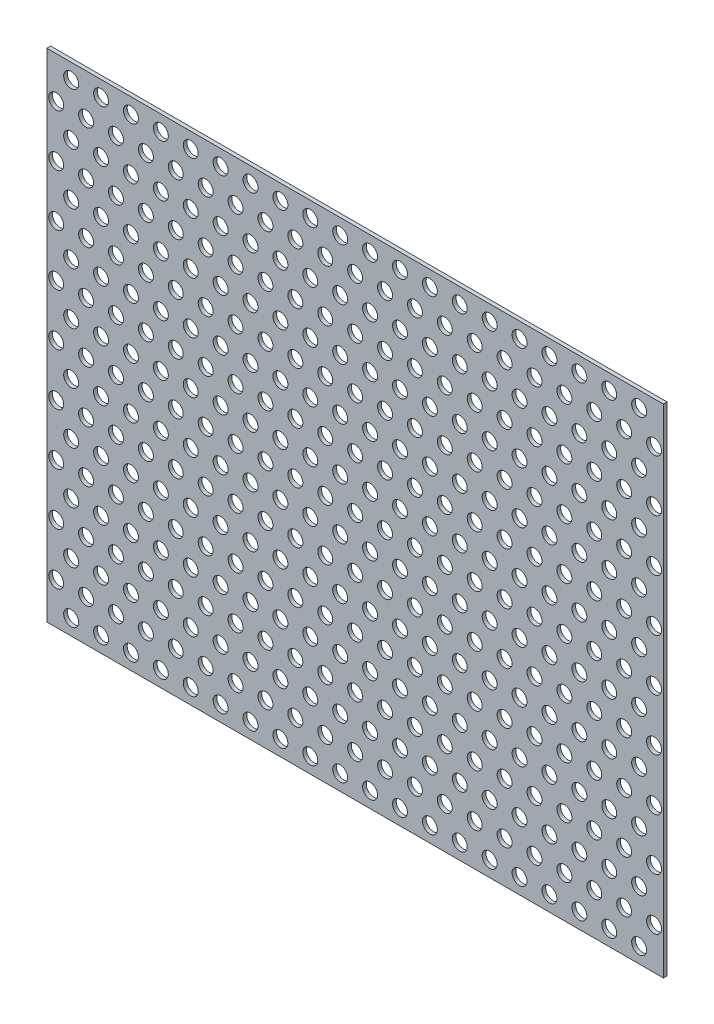
from build123d import *

# Parameters (mm, degrees)
SKICA1_W                  = 165
SKICA1_H                  = 135
Z_KLADN_PLECH1_DEPTH      = 1
POLE_START                = -1
POLE_VYPLN_N_M1_OUTLINE_R = 2
POLE_VYPLN_N_M1_DEPTH     = 1
SKICA4_W                  = 165
SKICA4_H                  = 1
ODEBRAT_VYSUNUT_M9_DEPTH  = 1


# Read off the part's stored shape, not the designer's step: Pole vyplněním1
# Sheet-metal steps are written as plain solids
with BuildPart() as part:
    # Skica1 → Základní plech1 (new body)
    with BuildSketch(Plane.XY):
        with Locations((82.5, 67.5)):
            Rectangle(SKICA1_W, SKICA1_H)
    extrude(amount=-Z_KLADN_PLECH1_DEPTH)

    # Pole vyplněním1 outline → Pole vyplněním1 (cut)
    with BuildSketch(Plane.XY.offset(POLE_START)):
        with Locations((2.5, 122.925625842)):
            Circle(POLE_VYPLN_N_M1_OUTLINE_R)
        with Locations((62.5, 129.853829072)):
            Circle(POLE_VYPLN_N_M1_OUTLINE_R)
        with Locations((62.5, 115.997422612)):
            Circle(POLE_VYPLN_N_M1_OUTLINE_R)
        with Locations((66.5, 109.069219382)):
            Circle(POLE_VYPLN_N_M1_OUTLINE_R)
        with Locations((74.5, 109.069219382)):
            Circle(POLE_VYPLN_N_M1_OUTLINE_R)
        with Locations((82.5, 109.069219382)):
            Circle(POLE_VYPLN_N_M1_OUTLINE_R)
        with Locations((90.5, 109.069219382)):
            Circle(POLE_VYPLN_N_M1_OUTLINE_R)
        with Locations((98.5, 109.069219382)):
            Circle(POLE_VYPLN_N_M1_OUTLINE_R)
        with Locations((106.5, 109.069219382)):
            Circle(POLE_VYPLN_N_M1_OUTLINE_R)
        with Locations((146.5, 109.069219382)):
            Circle(POLE_VYPLN_N_M1_OUTLINE_R)
        with Locations((154.5, 109.069219382)):
            Circle(POLE_VYPLN_N_M1_OUTLINE_R)
        with Locations((162.5, 109.069219382)):
            Circle(POLE_VYPLN_N_M1_OUTLINE_R)
        with Locations((66.5, 122.925625842)):
            Circle(POLE_VYPLN_N_M1_OUTLINE_R)
        with Locations((138.5, 109.069219382)):
            Circle(POLE_VYPLN_N_M1_OUTLINE_R)
        with Locations((130.5, 109.069219382)):
            Circle(POLE_VYPLN_N_M1_OUTLINE_R)
        with Locations((122.5, 109.069219382)):
            Circle(POLE_VYPLN_N_M1_OUTLINE_R)
        with Locations((114.5, 109.069219382)):
            Circle(POLE_VYPLN_N_M1_OUTLINE_R)
        with Locations((94.5, 102.141016151)):
            Circle(POLE_VYPLN_N_M1_OUTLINE_R)
        with Locations((86.5, 102.141016151)):
            Circle(POLE_VYPLN_N_M1_OUTLINE_R)
        with Locations((78.5, 102.141016151)):
            Circle(POLE_VYPLN_N_M1_OUTLINE_R)
        with Locations((70.5, 102.141016151)):
            Circle(POLE_VYPLN_N_M1_OUTLINE_R)
        with Locations((162.5, 95.212812921)):
            Circle(POLE_VYPLN_N_M1_OUTLINE_R)
        with Locations((58.5, 122.925625842)):
            Circle(POLE_VYPLN_N_M1_OUTLINE_R)
        with Locations((58.5, 109.069219382)):
            Circle(POLE_VYPLN_N_M1_OUTLINE_R)
        with Locations((62.5, 102.141016151)):
            Circle(POLE_VYPLN_N_M1_OUTLINE_R)
        with Locations((102.5, 102.141016151)):
            Circle(POLE_VYPLN_N_M1_OUTLINE_R)
        with Locations((110.5, 102.141016151)):
            Circle(POLE_VYPLN_N_M1_OUTLINE_R)
        with Locations((118.5, 102.141016151)):
            Circle(POLE_VYPLN_N_M1_OUTLINE_R)
        with Locations((126.5, 102.141016151)):
            Circle(POLE_VYPLN_N_M1_OUTLINE_R)
        with Locations((134.5, 102.141016151)):
            Circle(POLE_VYPLN_N_M1_OUTLINE_R)
        with Locations((142.5, 102.141016151)):
            Circle(POLE_VYPLN_N_M1_OUTLINE_R)
        with Locations((150.5, 102.141016151)):
            Circle(POLE_VYPLN_N_M1_OUTLINE_R)
        with Locations((158.5, 102.141016151)):
            Circle(POLE_VYPLN_N_M1_OUTLINE_R)
        with Locations((98.5, 122.925625842)):
            Circle(POLE_VYPLN_N_M1_OUTLINE_R)
        with Locations((106.5, 122.925625842)):
            Circle(POLE_VYPLN_N_M1_OUTLINE_R)
        with Locations((114.5, 122.925625842)):
            Circle(POLE_VYPLN_N_M1_OUTLINE_R)
        with Locations((122.5, 122.925625842)):
            Circle(POLE_VYPLN_N_M1_OUTLINE_R)
        with Locations((130.5, 122.925625842)):
            Circle(POLE_VYPLN_N_M1_OUTLINE_R)
        with Locations((138.5, 122.925625842)):
            Circle(POLE_VYPLN_N_M1_OUTLINE_R)
        with Locations((146.5, 122.925625842)):
            Circle(POLE_VYPLN_N_M1_OUTLINE_R)
        with Locations((154.5, 122.925625842)):
            Circle(POLE_VYPLN_N_M1_OUTLINE_R)
        with Locations((126.5, 129.853829072)):
            Circle(POLE_VYPLN_N_M1_OUTLINE_R)
        with Locations((118.5, 129.853829072)):
            Circle(POLE_VYPLN_N_M1_OUTLINE_R)
        with Locations((110.5, 129.853829072)):
            Circle(POLE_VYPLN_N_M1_OUTLINE_R)
        with Locations((102.5, 129.853829072)):
            Circle(POLE_VYPLN_N_M1_OUTLINE_R)
        with Locations((162.5, 122.925625842)):
            Circle(POLE_VYPLN_N_M1_OUTLINE_R)
        with Locations((78.5, 129.853829072)):
            Circle(POLE_VYPLN_N_M1_OUTLINE_R)
        with Locations((86.5, 129.853829072)):
            Circle(POLE_VYPLN_N_M1_OUTLINE_R)
        with Locations((94.5, 129.853829072)):
            Circle(POLE_VYPLN_N_M1_OUTLINE_R)
        with Locations((70.5, 115.997422612)):
            Circle(POLE_VYPLN_N_M1_OUTLINE_R)
        with Locations((78.5, 115.997422612)):
            Circle(POLE_VYPLN_N_M1_OUTLINE_R)
        with Locations((86.5, 115.997422612)):
            Circle(POLE_VYPLN_N_M1_OUTLINE_R)
        with Locations((94.5, 115.997422612)):
            Circle(POLE_VYPLN_N_M1_OUTLINE_R)
        with Locations((102.5, 115.997422612)):
            Circle(POLE_VYPLN_N_M1_OUTLINE_R)
        with Locations((110.5, 115.997422612)):
            Circle(POLE_VYPLN_N_M1_OUTLINE_R)
        with Locations((118.5, 115.997422612)):
            Circle(POLE_VYPLN_N_M1_OUTLINE_R)
        with Locations((126.5, 115.997422612)):
            Circle(POLE_VYPLN_N_M1_OUTLINE_R)
        with Locations((134.5, 115.997422612)):
            Circle(POLE_VYPLN_N_M1_OUTLINE_R)
        with Locations((142.5, 115.997422612)):
            Circle(POLE_VYPLN_N_M1_OUTLINE_R)
        with Locations((150.5, 115.997422612)):
            Circle(POLE_VYPLN_N_M1_OUTLINE_R)
        with Locations((158.5, 115.997422612)):
            Circle(POLE_VYPLN_N_M1_OUTLINE_R)
        with Locations((70.5, 129.853829072)):
            Circle(POLE_VYPLN_N_M1_OUTLINE_R)
        with Locations((74.5, 122.925625842)):
            Circle(POLE_VYPLN_N_M1_OUTLINE_R)
        with Locations((82.5, 122.925625842)):
            Circle(POLE_VYPLN_N_M1_OUTLINE_R)
        with Locations((90.5, 122.925625842)):
            Circle(POLE_VYPLN_N_M1_OUTLINE_R)
        with Locations((50.5, 81.356406461)):
            Circle(POLE_VYPLN_N_M1_OUTLINE_R)
        with Locations((58.5, 81.356406461)):
            Circle(POLE_VYPLN_N_M1_OUTLINE_R)
        with Locations((66.5, 81.356406461)):
            Circle(POLE_VYPLN_N_M1_OUTLINE_R)
        with Locations((74.5, 81.356406461)):
            Circle(POLE_VYPLN_N_M1_OUTLINE_R)
        with Locations((82.5, 81.356406461)):
            Circle(POLE_VYPLN_N_M1_OUTLINE_R)
        with Locations((90.5, 81.356406461)):
            Circle(POLE_VYPLN_N_M1_OUTLINE_R)
        with Locations((98.5, 81.356406461)):
            Circle(POLE_VYPLN_N_M1_OUTLINE_R)
        with Locations((106.5, 81.356406461)):
            Circle(POLE_VYPLN_N_M1_OUTLINE_R)
        with Locations((146.5, 81.356406461)):
            Circle(POLE_VYPLN_N_M1_OUTLINE_R)
        with Locations((154.5, 81.356406461)):
            Circle(POLE_VYPLN_N_M1_OUTLINE_R)
        with Locations((162.5, 81.356406461)):
            Circle(POLE_VYPLN_N_M1_OUTLINE_R)
        with Locations((50.5, 122.925625842)):
            Circle(POLE_VYPLN_N_M1_OUTLINE_R)
        with Locations((138.5, 81.356406461)):
            Circle(POLE_VYPLN_N_M1_OUTLINE_R)
        with Locations((130.5, 81.356406461)):
            Circle(POLE_VYPLN_N_M1_OUTLINE_R)
        with Locations((122.5, 81.356406461)):
            Circle(POLE_VYPLN_N_M1_OUTLINE_R)
        with Locations((114.5, 81.356406461)):
            Circle(POLE_VYPLN_N_M1_OUTLINE_R)
        with Locations((70.5, 74.42820323)):
            Circle(POLE_VYPLN_N_M1_OUTLINE_R)
        with Locations((78.5, 74.42820323)):
            Circle(POLE_VYPLN_N_M1_OUTLINE_R)
        with Locations((86.5, 74.42820323)):
            Circle(POLE_VYPLN_N_M1_OUTLINE_R)
        with Locations((94.5, 74.42820323)):
            Circle(POLE_VYPLN_N_M1_OUTLINE_R)
        with Locations((102.5, 74.42820323)):
            Circle(POLE_VYPLN_N_M1_OUTLINE_R)
        with Locations((110.5, 74.42820323)):
            Circle(POLE_VYPLN_N_M1_OUTLINE_R)
        with Locations((118.5, 74.42820323)):
            Circle(POLE_VYPLN_N_M1_OUTLINE_R)
        with Locations((126.5, 74.42820323)):
            Circle(POLE_VYPLN_N_M1_OUTLINE_R)
        with Locations((134.5, 74.42820323)):
            Circle(POLE_VYPLN_N_M1_OUTLINE_R)
        with Locations((142.5, 74.42820323)):
            Circle(POLE_VYPLN_N_M1_OUTLINE_R)
        with Locations((150.5, 74.42820323)):
            Circle(POLE_VYPLN_N_M1_OUTLINE_R)
        with Locations((158.5, 74.42820323)):
            Circle(POLE_VYPLN_N_M1_OUTLINE_R)
        with Locations((46.5, 129.853829072)):
            Circle(POLE_VYPLN_N_M1_OUTLINE_R)
        with Locations((46.5, 115.997422612)):
            Circle(POLE_VYPLN_N_M1_OUTLINE_R)
        with Locations((46.5, 102.141016151)):
            Circle(POLE_VYPLN_N_M1_OUTLINE_R)
        with Locations((46.5, 88.284609691)):
            Circle(POLE_VYPLN_N_M1_OUTLINE_R)
        with Locations((154.5, 95.212812921)):
            Circle(POLE_VYPLN_N_M1_OUTLINE_R)
        with Locations((146.5, 95.212812921)):
            Circle(POLE_VYPLN_N_M1_OUTLINE_R)
        with Locations((138.5, 95.212812921)):
            Circle(POLE_VYPLN_N_M1_OUTLINE_R)
        with Locations((130.5, 95.212812921)):
            Circle(POLE_VYPLN_N_M1_OUTLINE_R)
        with Locations((122.5, 95.212812921)):
            Circle(POLE_VYPLN_N_M1_OUTLINE_R)
        with Locations((114.5, 95.212812921)):
            Circle(POLE_VYPLN_N_M1_OUTLINE_R)
        with Locations((106.5, 95.212812921)):
            Circle(POLE_VYPLN_N_M1_OUTLINE_R)
        with Locations((98.5, 95.212812921)):
            Circle(POLE_VYPLN_N_M1_OUTLINE_R)
        with Locations((90.5, 95.212812921)):
            Circle(POLE_VYPLN_N_M1_OUTLINE_R)
        with Locations((82.5, 95.212812921)):
            Circle(POLE_VYPLN_N_M1_OUTLINE_R)
        with Locations((74.5, 95.212812921)):
            Circle(POLE_VYPLN_N_M1_OUTLINE_R)
        with Locations((66.5, 95.212812921)):
            Circle(POLE_VYPLN_N_M1_OUTLINE_R)
        with Locations((58.5, 95.212812921)):
            Circle(POLE_VYPLN_N_M1_OUTLINE_R)
        with Locations((54.5, 102.141016151)):
            Circle(POLE_VYPLN_N_M1_OUTLINE_R)
        with Locations((54.5, 115.997422612)):
            Circle(POLE_VYPLN_N_M1_OUTLINE_R)
        with Locations((54.5, 129.853829072)):
            Circle(POLE_VYPLN_N_M1_OUTLINE_R)
        with Locations((158.5, 88.284609691)):
            Circle(POLE_VYPLN_N_M1_OUTLINE_R)
        with Locations((150.5, 88.284609691)):
            Circle(POLE_VYPLN_N_M1_OUTLINE_R)
        with Locations((142.5, 88.284609691)):
            Circle(POLE_VYPLN_N_M1_OUTLINE_R)
        with Locations((134.5, 88.284609691)):
            Circle(POLE_VYPLN_N_M1_OUTLINE_R)
        with Locations((126.5, 88.284609691)):
            Circle(POLE_VYPLN_N_M1_OUTLINE_R)
        with Locations((118.5, 88.284609691)):
            Circle(POLE_VYPLN_N_M1_OUTLINE_R)
        with Locations((110.5, 88.284609691)):
            Circle(POLE_VYPLN_N_M1_OUTLINE_R)
        with Locations((102.5, 88.284609691)):
            Circle(POLE_VYPLN_N_M1_OUTLINE_R)
        with Locations((94.5, 88.284609691)):
            Circle(POLE_VYPLN_N_M1_OUTLINE_R)
        with Locations((86.5, 88.284609691)):
            Circle(POLE_VYPLN_N_M1_OUTLINE_R)
        with Locations((78.5, 88.284609691)):
            Circle(POLE_VYPLN_N_M1_OUTLINE_R)
        with Locations((70.5, 88.284609691)):
            Circle(POLE_VYPLN_N_M1_OUTLINE_R)
        with Locations((62.5, 88.284609691)):
            Circle(POLE_VYPLN_N_M1_OUTLINE_R)
        with Locations((54.5, 88.284609691)):
            Circle(POLE_VYPLN_N_M1_OUTLINE_R)
        with Locations((50.5, 95.212812921)):
            Circle(POLE_VYPLN_N_M1_OUTLINE_R)
        with Locations((50.5, 109.069219382)):
            Circle(POLE_VYPLN_N_M1_OUTLINE_R)
        with Locations((134.5, 129.853829072)):
            Circle(POLE_VYPLN_N_M1_OUTLINE_R)
        with Locations((142.5, 129.853829072)):
            Circle(POLE_VYPLN_N_M1_OUTLINE_R)
        with Locations((150.5, 129.853829072)):
            Circle(POLE_VYPLN_N_M1_OUTLINE_R)
        with Locations((158.5, 129.853829072)):
            Circle(POLE_VYPLN_N_M1_OUTLINE_R)
        with Locations((134.5, 19.002577388)):
            Circle(POLE_VYPLN_N_M1_OUTLINE_R)
        with Locations((142.5, 19.002577388)):
            Circle(POLE_VYPLN_N_M1_OUTLINE_R)
        with Locations((150.5, 19.002577388)):
            Circle(POLE_VYPLN_N_M1_OUTLINE_R)
        with Locations((158.5, 19.002577388)):
            Circle(POLE_VYPLN_N_M1_OUTLINE_R)
        with Locations((14.5, 129.853829072)):
            Circle(POLE_VYPLN_N_M1_OUTLINE_R)
        with Locations((14.5, 115.997422612)):
            Circle(POLE_VYPLN_N_M1_OUTLINE_R)
        with Locations((14.5, 102.141016151)):
            Circle(POLE_VYPLN_N_M1_OUTLINE_R)
        with Locations((14.5, 88.284609691)):
            Circle(POLE_VYPLN_N_M1_OUTLINE_R)
        with Locations((14.5, 74.42820323)):
            Circle(POLE_VYPLN_N_M1_OUTLINE_R)
        with Locations((14.5, 60.57179677)):
            Circle(POLE_VYPLN_N_M1_OUTLINE_R)
        with Locations((14.5, 46.715390309)):
            Circle(POLE_VYPLN_N_M1_OUTLINE_R)
        with Locations((14.5, 32.858983849)):
            Circle(POLE_VYPLN_N_M1_OUTLINE_R)
        with Locations((18.5, 25.930780618)):
            Circle(POLE_VYPLN_N_M1_OUTLINE_R)
        with Locations((26.5, 25.930780618)):
            Circle(POLE_VYPLN_N_M1_OUTLINE_R)
        with Locations((34.5, 25.930780618)):
            Circle(POLE_VYPLN_N_M1_OUTLINE_R)
        with Locations((42.5, 25.930780618)):
            Circle(POLE_VYPLN_N_M1_OUTLINE_R)
        with Locations((126.5, 19.002577388)):
            Circle(POLE_VYPLN_N_M1_OUTLINE_R)
        with Locations((118.5, 19.002577388)):
            Circle(POLE_VYPLN_N_M1_OUTLINE_R)
        with Locations((110.5, 19.002577388)):
            Circle(POLE_VYPLN_N_M1_OUTLINE_R)
        with Locations((102.5, 19.002577388)):
            Circle(POLE_VYPLN_N_M1_OUTLINE_R)
        with Locations((94.5, 19.002577388)):
            Circle(POLE_VYPLN_N_M1_OUTLINE_R)
        with Locations((86.5, 19.002577388)):
            Circle(POLE_VYPLN_N_M1_OUTLINE_R)
        with Locations((78.5, 19.002577388)):
            Circle(POLE_VYPLN_N_M1_OUTLINE_R)
        with Locations((70.5, 19.002577388)):
            Circle(POLE_VYPLN_N_M1_OUTLINE_R)
        with Locations((62.5, 19.002577388)):
            Circle(POLE_VYPLN_N_M1_OUTLINE_R)
        with Locations((54.5, 19.002577388)):
            Circle(POLE_VYPLN_N_M1_OUTLINE_R)
        with Locations((46.5, 19.002577388)):
            Circle(POLE_VYPLN_N_M1_OUTLINE_R)
        with Locations((38.5, 19.002577388)):
            Circle(POLE_VYPLN_N_M1_OUTLINE_R)
        with Locations((30.5, 19.002577388)):
            Circle(POLE_VYPLN_N_M1_OUTLINE_R)
        with Locations((22.5, 19.002577388)):
            Circle(POLE_VYPLN_N_M1_OUTLINE_R)
        with Locations((14.5, 19.002577388)):
            Circle(POLE_VYPLN_N_M1_OUTLINE_R)
        with Locations((10.5, 25.930780618)):
            Circle(POLE_VYPLN_N_M1_OUTLINE_R)
        with Locations((94.5, 32.858983849)):
            Circle(POLE_VYPLN_N_M1_OUTLINE_R)
        with Locations((86.5, 32.858983849)):
            Circle(POLE_VYPLN_N_M1_OUTLINE_R)
        with Locations((78.5, 32.858983849)):
            Circle(POLE_VYPLN_N_M1_OUTLINE_R)
        with Locations((70.5, 32.858983849)):
            Circle(POLE_VYPLN_N_M1_OUTLINE_R)
        with Locations((62.5, 32.858983849)):
            Circle(POLE_VYPLN_N_M1_OUTLINE_R)
        with Locations((54.5, 32.858983849)):
            Circle(POLE_VYPLN_N_M1_OUTLINE_R)
        with Locations((46.5, 32.858983849)):
            Circle(POLE_VYPLN_N_M1_OUTLINE_R)
        with Locations((38.5, 32.858983849)):
            Circle(POLE_VYPLN_N_M1_OUTLINE_R)
        with Locations((30.5, 32.858983849)):
            Circle(POLE_VYPLN_N_M1_OUTLINE_R)
        with Locations((22.5, 32.858983849)):
            Circle(POLE_VYPLN_N_M1_OUTLINE_R)
        with Locations((18.5, 39.787187079)):
            Circle(POLE_VYPLN_N_M1_OUTLINE_R)
        with Locations((18.5, 53.643593539)):
            Circle(POLE_VYPLN_N_M1_OUTLINE_R)
        with Locations((18.5, 67.5)):
            Circle(POLE_VYPLN_N_M1_OUTLINE_R)
        with Locations((18.5, 81.356406461)):
            Circle(POLE_VYPLN_N_M1_OUTLINE_R)
        with Locations((18.5, 95.212812921)):
            Circle(POLE_VYPLN_N_M1_OUTLINE_R)
        with Locations((18.5, 109.069219382)):
            Circle(POLE_VYPLN_N_M1_OUTLINE_R)
        with Locations((50.5, 25.930780618)):
            Circle(POLE_VYPLN_N_M1_OUTLINE_R)
        with Locations((58.5, 25.930780618)):
            Circle(POLE_VYPLN_N_M1_OUTLINE_R)
        with Locations((66.5, 25.930780618)):
            Circle(POLE_VYPLN_N_M1_OUTLINE_R)
        with Locations((74.5, 25.930780618)):
            Circle(POLE_VYPLN_N_M1_OUTLINE_R)
        with Locations((82.5, 25.930780618)):
            Circle(POLE_VYPLN_N_M1_OUTLINE_R)
        with Locations((90.5, 25.930780618)):
            Circle(POLE_VYPLN_N_M1_OUTLINE_R)
        with Locations((98.5, 25.930780618)):
            Circle(POLE_VYPLN_N_M1_OUTLINE_R)
        with Locations((106.5, 25.930780618)):
            Circle(POLE_VYPLN_N_M1_OUTLINE_R)
        with Locations((146.5, 25.930780618)):
            Circle(POLE_VYPLN_N_M1_OUTLINE_R)
        with Locations((154.5, 25.930780618)):
            Circle(POLE_VYPLN_N_M1_OUTLINE_R)
        with Locations((162.5, 25.930780618)):
            Circle(POLE_VYPLN_N_M1_OUTLINE_R)
        with Locations((18.5, 122.925625842)):
            Circle(POLE_VYPLN_N_M1_OUTLINE_R)
        with Locations((138.5, 25.930780618)):
            Circle(POLE_VYPLN_N_M1_OUTLINE_R)
        with Locations((130.5, 25.930780618)):
            Circle(POLE_VYPLN_N_M1_OUTLINE_R)
        with Locations((122.5, 25.930780618)):
            Circle(POLE_VYPLN_N_M1_OUTLINE_R)
        with Locations((114.5, 25.930780618)):
            Circle(POLE_VYPLN_N_M1_OUTLINE_R)
        with Locations((70.5, 5.146170928)):
            Circle(POLE_VYPLN_N_M1_OUTLINE_R)
        with Locations((78.5, 5.146170928)):
            Circle(POLE_VYPLN_N_M1_OUTLINE_R)
        with Locations((86.5, 5.146170928)):
            Circle(POLE_VYPLN_N_M1_OUTLINE_R)
        with Locations((94.5, 5.146170928)):
            Circle(POLE_VYPLN_N_M1_OUTLINE_R)
        with Locations((102.5, 5.146170928)):
            Circle(POLE_VYPLN_N_M1_OUTLINE_R)
        with Locations((110.5, 5.146170928)):
            Circle(POLE_VYPLN_N_M1_OUTLINE_R)
        with Locations((118.5, 5.146170928)):
            Circle(POLE_VYPLN_N_M1_OUTLINE_R)
        with Locations((126.5, 5.146170928)):
            Circle(POLE_VYPLN_N_M1_OUTLINE_R)
        with Locations((134.5, 5.146170928)):
            Circle(POLE_VYPLN_N_M1_OUTLINE_R)
        with Locations((142.5, 5.146170928)):
            Circle(POLE_VYPLN_N_M1_OUTLINE_R)
        with Locations((150.5, 5.146170928)):
            Circle(POLE_VYPLN_N_M1_OUTLINE_R)
        with Locations((158.5, 5.146170928)):
            Circle(POLE_VYPLN_N_M1_OUTLINE_R)
        with Locations((6.5, 129.853829072)):
            Circle(POLE_VYPLN_N_M1_OUTLINE_R)
        with Locations((6.5, 115.997422612)):
            Circle(POLE_VYPLN_N_M1_OUTLINE_R)
        with Locations((6.5, 102.141016151)):
            Circle(POLE_VYPLN_N_M1_OUTLINE_R)
        with Locations((6.5, 88.284609691)):
            Circle(POLE_VYPLN_N_M1_OUTLINE_R)
        with Locations((62.5, 5.146170928)):
            Circle(POLE_VYPLN_N_M1_OUTLINE_R)
        with Locations((54.5, 5.146170928)):
            Circle(POLE_VYPLN_N_M1_OUTLINE_R)
        with Locations((46.5, 5.146170928)):
            Circle(POLE_VYPLN_N_M1_OUTLINE_R)
        with Locations((38.5, 5.146170928)):
            Circle(POLE_VYPLN_N_M1_OUTLINE_R)
        with Locations((30.5, 5.146170928)):
            Circle(POLE_VYPLN_N_M1_OUTLINE_R)
        with Locations((22.5, 5.146170928)):
            Circle(POLE_VYPLN_N_M1_OUTLINE_R)
        with Locations((14.5, 5.146170928)):
            Circle(POLE_VYPLN_N_M1_OUTLINE_R)
        with Locations((6.5, 5.146170928)):
            Circle(POLE_VYPLN_N_M1_OUTLINE_R)
        with Locations((2.5, 12.074374158)):
            Circle(POLE_VYPLN_N_M1_OUTLINE_R)
        with Locations((2.5, 25.930780618)):
            Circle(POLE_VYPLN_N_M1_OUTLINE_R)
        with Locations((2.5, 39.787187079)):
            Circle(POLE_VYPLN_N_M1_OUTLINE_R)
        with Locations((2.5, 53.643593539)):
            Circle(POLE_VYPLN_N_M1_OUTLINE_R)
        with Locations((2.5, 67.5)):
            Circle(POLE_VYPLN_N_M1_OUTLINE_R)
        with Locations((2.5, 81.356406461)):
            Circle(POLE_VYPLN_N_M1_OUTLINE_R)
        with Locations((2.5, 95.212812921)):
            Circle(POLE_VYPLN_N_M1_OUTLINE_R)
        with Locations((2.5, 109.069219382)):
            Circle(POLE_VYPLN_N_M1_OUTLINE_R)
        with Locations((98.5, 12.074374158)):
            Circle(POLE_VYPLN_N_M1_OUTLINE_R)
        with Locations((106.5, 12.074374158)):
            Circle(POLE_VYPLN_N_M1_OUTLINE_R)
        with Locations((114.5, 12.074374158)):
            Circle(POLE_VYPLN_N_M1_OUTLINE_R)
        with Locations((122.5, 12.074374158)):
            Circle(POLE_VYPLN_N_M1_OUTLINE_R)
        with Locations((130.5, 12.074374158)):
            Circle(POLE_VYPLN_N_M1_OUTLINE_R)
        with Locations((138.5, 12.074374158)):
            Circle(POLE_VYPLN_N_M1_OUTLINE_R)
        with Locations((146.5, 12.074374158)):
            Circle(POLE_VYPLN_N_M1_OUTLINE_R)
        with Locations((154.5, 12.074374158)):
            Circle(POLE_VYPLN_N_M1_OUTLINE_R)
        with Locations((10.5, 39.787187079)):
            Circle(POLE_VYPLN_N_M1_OUTLINE_R)
        with Locations((10.5, 53.643593539)):
            Circle(POLE_VYPLN_N_M1_OUTLINE_R)
        with Locations((10.5, 67.5)):
            Circle(POLE_VYPLN_N_M1_OUTLINE_R)
        with Locations((10.5, 81.356406461)):
            Circle(POLE_VYPLN_N_M1_OUTLINE_R)
        with Locations((162.5, 12.074374158)):
            Circle(POLE_VYPLN_N_M1_OUTLINE_R)
        with Locations((10.5, 122.925625842)):
            Circle(POLE_VYPLN_N_M1_OUTLINE_R)
        with Locations((10.5, 109.069219382)):
            Circle(POLE_VYPLN_N_M1_OUTLINE_R)
        with Locations((10.5, 95.212812921)):
            Circle(POLE_VYPLN_N_M1_OUTLINE_R)
        with Locations((90.5, 12.074374158)):
            Circle(POLE_VYPLN_N_M1_OUTLINE_R)
        with Locations((82.5, 12.074374158)):
            Circle(POLE_VYPLN_N_M1_OUTLINE_R)
        with Locations((74.5, 12.074374158)):
            Circle(POLE_VYPLN_N_M1_OUTLINE_R)
        with Locations((66.5, 12.074374158)):
            Circle(POLE_VYPLN_N_M1_OUTLINE_R)
        with Locations((58.5, 12.074374158)):
            Circle(POLE_VYPLN_N_M1_OUTLINE_R)
        with Locations((50.5, 12.074374158)):
            Circle(POLE_VYPLN_N_M1_OUTLINE_R)
        with Locations((42.5, 12.074374158)):
            Circle(POLE_VYPLN_N_M1_OUTLINE_R)
        with Locations((34.5, 12.074374158)):
            Circle(POLE_VYPLN_N_M1_OUTLINE_R)
        with Locations((26.5, 12.074374158)):
            Circle(POLE_VYPLN_N_M1_OUTLINE_R)
        with Locations((18.5, 12.074374158)):
            Circle(POLE_VYPLN_N_M1_OUTLINE_R)
        with Locations((10.5, 12.074374158)):
            Circle(POLE_VYPLN_N_M1_OUTLINE_R)
        with Locations((6.5, 19.002577388)):
            Circle(POLE_VYPLN_N_M1_OUTLINE_R)
        with Locations((6.5, 32.858983849)):
            Circle(POLE_VYPLN_N_M1_OUTLINE_R)
        with Locations((6.5, 46.715390309)):
            Circle(POLE_VYPLN_N_M1_OUTLINE_R)
        with Locations((6.5, 60.57179677)):
            Circle(POLE_VYPLN_N_M1_OUTLINE_R)
        with Locations((6.5, 74.42820323)):
            Circle(POLE_VYPLN_N_M1_OUTLINE_R)
        with Locations((126.5, 60.57179677)):
            Circle(POLE_VYPLN_N_M1_OUTLINE_R)
        with Locations((118.5, 60.57179677)):
            Circle(POLE_VYPLN_N_M1_OUTLINE_R)
        with Locations((110.5, 60.57179677)):
            Circle(POLE_VYPLN_N_M1_OUTLINE_R)
        with Locations((102.5, 60.57179677)):
            Circle(POLE_VYPLN_N_M1_OUTLINE_R)
        with Locations((94.5, 60.57179677)):
            Circle(POLE_VYPLN_N_M1_OUTLINE_R)
        with Locations((86.5, 60.57179677)):
            Circle(POLE_VYPLN_N_M1_OUTLINE_R)
        with Locations((78.5, 60.57179677)):
            Circle(POLE_VYPLN_N_M1_OUTLINE_R)
        with Locations((70.5, 60.57179677)):
            Circle(POLE_VYPLN_N_M1_OUTLINE_R)
        with Locations((62.5, 60.57179677)):
            Circle(POLE_VYPLN_N_M1_OUTLINE_R)
        with Locations((54.5, 60.57179677)):
            Circle(POLE_VYPLN_N_M1_OUTLINE_R)
        with Locations((46.5, 60.57179677)):
            Circle(POLE_VYPLN_N_M1_OUTLINE_R)
        with Locations((38.5, 60.57179677)):
            Circle(POLE_VYPLN_N_M1_OUTLINE_R)
        with Locations((34.5, 67.5)):
            Circle(POLE_VYPLN_N_M1_OUTLINE_R)
        with Locations((34.5, 81.356406461)):
            Circle(POLE_VYPLN_N_M1_OUTLINE_R)
        with Locations((34.5, 95.212812921)):
            Circle(POLE_VYPLN_N_M1_OUTLINE_R)
        with Locations((34.5, 109.069219382)):
            Circle(POLE_VYPLN_N_M1_OUTLINE_R)
        with Locations((50.5, 53.643593539)):
            Circle(POLE_VYPLN_N_M1_OUTLINE_R)
        with Locations((58.5, 53.643593539)):
            Circle(POLE_VYPLN_N_M1_OUTLINE_R)
        with Locations((66.5, 53.643593539)):
            Circle(POLE_VYPLN_N_M1_OUTLINE_R)
        with Locations((74.5, 53.643593539)):
            Circle(POLE_VYPLN_N_M1_OUTLINE_R)
        with Locations((82.5, 53.643593539)):
            Circle(POLE_VYPLN_N_M1_OUTLINE_R)
        with Locations((90.5, 53.643593539)):
            Circle(POLE_VYPLN_N_M1_OUTLINE_R)
        with Locations((98.5, 53.643593539)):
            Circle(POLE_VYPLN_N_M1_OUTLINE_R)
        with Locations((106.5, 53.643593539)):
            Circle(POLE_VYPLN_N_M1_OUTLINE_R)
        with Locations((146.5, 53.643593539)):
            Circle(POLE_VYPLN_N_M1_OUTLINE_R)
        with Locations((154.5, 53.643593539)):
            Circle(POLE_VYPLN_N_M1_OUTLINE_R)
        with Locations((162.5, 53.643593539)):
            Circle(POLE_VYPLN_N_M1_OUTLINE_R)
        with Locations((34.5, 122.925625842)):
            Circle(POLE_VYPLN_N_M1_OUTLINE_R)
        with Locations((138.5, 53.643593539)):
            Circle(POLE_VYPLN_N_M1_OUTLINE_R)
        with Locations((130.5, 53.643593539)):
            Circle(POLE_VYPLN_N_M1_OUTLINE_R)
        with Locations((122.5, 53.643593539)):
            Circle(POLE_VYPLN_N_M1_OUTLINE_R)
        with Locations((114.5, 53.643593539)):
            Circle(POLE_VYPLN_N_M1_OUTLINE_R)
        with Locations((98.5, 67.5)):
            Circle(POLE_VYPLN_N_M1_OUTLINE_R)
        with Locations((106.5, 67.5)):
            Circle(POLE_VYPLN_N_M1_OUTLINE_R)
        with Locations((114.5, 67.5)):
            Circle(POLE_VYPLN_N_M1_OUTLINE_R)
        with Locations((122.5, 67.5)):
            Circle(POLE_VYPLN_N_M1_OUTLINE_R)
        with Locations((130.5, 67.5)):
            Circle(POLE_VYPLN_N_M1_OUTLINE_R)
        with Locations((138.5, 67.5)):
            Circle(POLE_VYPLN_N_M1_OUTLINE_R)
        with Locations((146.5, 67.5)):
            Circle(POLE_VYPLN_N_M1_OUTLINE_R)
        with Locations((154.5, 67.5)):
            Circle(POLE_VYPLN_N_M1_OUTLINE_R)
        with Locations((62.5, 74.42820323)):
            Circle(POLE_VYPLN_N_M1_OUTLINE_R)
        with Locations((54.5, 74.42820323)):
            Circle(POLE_VYPLN_N_M1_OUTLINE_R)
        with Locations((46.5, 74.42820323)):
            Circle(POLE_VYPLN_N_M1_OUTLINE_R)
        with Locations((42.5, 81.356406461)):
            Circle(POLE_VYPLN_N_M1_OUTLINE_R)
        with Locations((162.5, 67.5)):
            Circle(POLE_VYPLN_N_M1_OUTLINE_R)
        with Locations((42.5, 122.925625842)):
            Circle(POLE_VYPLN_N_M1_OUTLINE_R)
        with Locations((42.5, 109.069219382)):
            Circle(POLE_VYPLN_N_M1_OUTLINE_R)
        with Locations((42.5, 95.212812921)):
            Circle(POLE_VYPLN_N_M1_OUTLINE_R)
        with Locations((134.5, 60.57179677)):
            Circle(POLE_VYPLN_N_M1_OUTLINE_R)
        with Locations((142.5, 60.57179677)):
            Circle(POLE_VYPLN_N_M1_OUTLINE_R)
        with Locations((150.5, 60.57179677)):
            Circle(POLE_VYPLN_N_M1_OUTLINE_R)
        with Locations((158.5, 60.57179677)):
            Circle(POLE_VYPLN_N_M1_OUTLINE_R)
        with Locations((38.5, 129.853829072)):
            Circle(POLE_VYPLN_N_M1_OUTLINE_R)
        with Locations((38.5, 115.997422612)):
            Circle(POLE_VYPLN_N_M1_OUTLINE_R)
        with Locations((38.5, 102.141016151)):
            Circle(POLE_VYPLN_N_M1_OUTLINE_R)
        with Locations((38.5, 88.284609691)):
            Circle(POLE_VYPLN_N_M1_OUTLINE_R)
        with Locations((38.5, 74.42820323)):
            Circle(POLE_VYPLN_N_M1_OUTLINE_R)
        with Locations((42.5, 67.5)):
            Circle(POLE_VYPLN_N_M1_OUTLINE_R)
        with Locations((50.5, 67.5)):
            Circle(POLE_VYPLN_N_M1_OUTLINE_R)
        with Locations((58.5, 67.5)):
            Circle(POLE_VYPLN_N_M1_OUTLINE_R)
        with Locations((66.5, 67.5)):
            Circle(POLE_VYPLN_N_M1_OUTLINE_R)
        with Locations((74.5, 67.5)):
            Circle(POLE_VYPLN_N_M1_OUTLINE_R)
        with Locations((82.5, 67.5)):
            Circle(POLE_VYPLN_N_M1_OUTLINE_R)
        with Locations((90.5, 67.5)):
            Circle(POLE_VYPLN_N_M1_OUTLINE_R)
        with Locations((154.5, 39.787187079)):
            Circle(POLE_VYPLN_N_M1_OUTLINE_R)
        with Locations((146.5, 39.787187079)):
            Circle(POLE_VYPLN_N_M1_OUTLINE_R)
        with Locations((138.5, 39.787187079)):
            Circle(POLE_VYPLN_N_M1_OUTLINE_R)
        with Locations((130.5, 39.787187079)):
            Circle(POLE_VYPLN_N_M1_OUTLINE_R)
        with Locations((122.5, 39.787187079)):
            Circle(POLE_VYPLN_N_M1_OUTLINE_R)
        with Locations((114.5, 39.787187079)):
            Circle(POLE_VYPLN_N_M1_OUTLINE_R)
        with Locations((106.5, 39.787187079)):
            Circle(POLE_VYPLN_N_M1_OUTLINE_R)
        with Locations((98.5, 39.787187079)):
            Circle(POLE_VYPLN_N_M1_OUTLINE_R)
        with Locations((90.5, 39.787187079)):
            Circle(POLE_VYPLN_N_M1_OUTLINE_R)
        with Locations((82.5, 39.787187079)):
            Circle(POLE_VYPLN_N_M1_OUTLINE_R)
        with Locations((74.5, 39.787187079)):
            Circle(POLE_VYPLN_N_M1_OUTLINE_R)
        with Locations((66.5, 39.787187079)):
            Circle(POLE_VYPLN_N_M1_OUTLINE_R)
        with Locations((58.5, 39.787187079)):
            Circle(POLE_VYPLN_N_M1_OUTLINE_R)
        with Locations((50.5, 39.787187079)):
            Circle(POLE_VYPLN_N_M1_OUTLINE_R)
        with Locations((42.5, 39.787187079)):
            Circle(POLE_VYPLN_N_M1_OUTLINE_R)
        with Locations((34.5, 39.787187079)):
            Circle(POLE_VYPLN_N_M1_OUTLINE_R)
        with Locations((26.5, 39.787187079)):
            Circle(POLE_VYPLN_N_M1_OUTLINE_R)
        with Locations((22.5, 46.715390309)):
            Circle(POLE_VYPLN_N_M1_OUTLINE_R)
        with Locations((22.5, 60.57179677)):
            Circle(POLE_VYPLN_N_M1_OUTLINE_R)
        with Locations((22.5, 74.42820323)):
            Circle(POLE_VYPLN_N_M1_OUTLINE_R)
        with Locations((22.5, 88.284609691)):
            Circle(POLE_VYPLN_N_M1_OUTLINE_R)
        with Locations((22.5, 102.141016151)):
            Circle(POLE_VYPLN_N_M1_OUTLINE_R)
        with Locations((22.5, 115.997422612)):
            Circle(POLE_VYPLN_N_M1_OUTLINE_R)
        with Locations((22.5, 129.853829072)):
            Circle(POLE_VYPLN_N_M1_OUTLINE_R)
        with Locations((158.5, 32.858983849)):
            Circle(POLE_VYPLN_N_M1_OUTLINE_R)
        with Locations((150.5, 32.858983849)):
            Circle(POLE_VYPLN_N_M1_OUTLINE_R)
        with Locations((142.5, 32.858983849)):
            Circle(POLE_VYPLN_N_M1_OUTLINE_R)
        with Locations((134.5, 32.858983849)):
            Circle(POLE_VYPLN_N_M1_OUTLINE_R)
        with Locations((126.5, 32.858983849)):
            Circle(POLE_VYPLN_N_M1_OUTLINE_R)
        with Locations((118.5, 32.858983849)):
            Circle(POLE_VYPLN_N_M1_OUTLINE_R)
        with Locations((110.5, 32.858983849)):
            Circle(POLE_VYPLN_N_M1_OUTLINE_R)
        with Locations((102.5, 32.858983849)):
            Circle(POLE_VYPLN_N_M1_OUTLINE_R)
        with Locations((42.5, 53.643593539)):
            Circle(POLE_VYPLN_N_M1_OUTLINE_R)
        with Locations((34.5, 53.643593539)):
            Circle(POLE_VYPLN_N_M1_OUTLINE_R)
        with Locations((30.5, 60.57179677)):
            Circle(POLE_VYPLN_N_M1_OUTLINE_R)
        with Locations((30.5, 74.42820323)):
            Circle(POLE_VYPLN_N_M1_OUTLINE_R)
        with Locations((30.5, 88.284609691)):
            Circle(POLE_VYPLN_N_M1_OUTLINE_R)
        with Locations((30.5, 102.141016151)):
            Circle(POLE_VYPLN_N_M1_OUTLINE_R)
        with Locations((30.5, 115.997422612)):
            Circle(POLE_VYPLN_N_M1_OUTLINE_R)
        with Locations((30.5, 129.853829072)):
            Circle(POLE_VYPLN_N_M1_OUTLINE_R)
        with Locations((158.5, 46.715390309)):
            Circle(POLE_VYPLN_N_M1_OUTLINE_R)
        with Locations((150.5, 46.715390309)):
            Circle(POLE_VYPLN_N_M1_OUTLINE_R)
        with Locations((142.5, 46.715390309)):
            Circle(POLE_VYPLN_N_M1_OUTLINE_R)
        with Locations((134.5, 46.715390309)):
            Circle(POLE_VYPLN_N_M1_OUTLINE_R)
        with Locations((126.5, 46.715390309)):
            Circle(POLE_VYPLN_N_M1_OUTLINE_R)
        with Locations((118.5, 46.715390309)):
            Circle(POLE_VYPLN_N_M1_OUTLINE_R)
        with Locations((110.5, 46.715390309)):
            Circle(POLE_VYPLN_N_M1_OUTLINE_R)
        with Locations((102.5, 46.715390309)):
            Circle(POLE_VYPLN_N_M1_OUTLINE_R)
        with Locations((30.5, 46.715390309)):
            Circle(POLE_VYPLN_N_M1_OUTLINE_R)
        with Locations((26.5, 53.643593539)):
            Circle(POLE_VYPLN_N_M1_OUTLINE_R)
        with Locations((26.5, 67.5)):
            Circle(POLE_VYPLN_N_M1_OUTLINE_R)
        with Locations((26.5, 81.356406461)):
            Circle(POLE_VYPLN_N_M1_OUTLINE_R)
        with Locations((162.5, 39.787187079)):
            Circle(POLE_VYPLN_N_M1_OUTLINE_R)
        with Locations((26.5, 122.925625842)):
            Circle(POLE_VYPLN_N_M1_OUTLINE_R)
        with Locations((26.5, 109.069219382)):
            Circle(POLE_VYPLN_N_M1_OUTLINE_R)
        with Locations((26.5, 95.212812921)):
            Circle(POLE_VYPLN_N_M1_OUTLINE_R)
        with Locations((38.5, 46.715390309)):
            Circle(POLE_VYPLN_N_M1_OUTLINE_R)
        with Locations((46.5, 46.715390309)):
            Circle(POLE_VYPLN_N_M1_OUTLINE_R)
        with Locations((54.5, 46.715390309)):
            Circle(POLE_VYPLN_N_M1_OUTLINE_R)
        with Locations((62.5, 46.715390309)):
            Circle(POLE_VYPLN_N_M1_OUTLINE_R)
        with Locations((70.5, 46.715390309)):
            Circle(POLE_VYPLN_N_M1_OUTLINE_R)
        with Locations((78.5, 46.715390309)):
            Circle(POLE_VYPLN_N_M1_OUTLINE_R)
        with Locations((86.5, 46.715390309)):
            Circle(POLE_VYPLN_N_M1_OUTLINE_R)
        with Locations((94.5, 46.715390309)):
            Circle(POLE_VYPLN_N_M1_OUTLINE_R)
    extrude(amount=POLE_VYPLN_N_M1_DEPTH, mode=Mode.SUBTRACT)

    # Skica4 → Odebrat vysunutím9 (cut)
    with BuildSketch(Plane.XY):
        with Locations((82.5, 134.5)):
            Rectangle(SKICA4_W, SKICA4_H)
        with Locations((82.5, 0.5)):
            Rectangle(SKICA4_W, SKICA4_H)
    extrude(amount=-ODEBRAT_VYSUNUT_M9_DEPTH, mode=Mode.SUBTRACT)


solid = part.part
